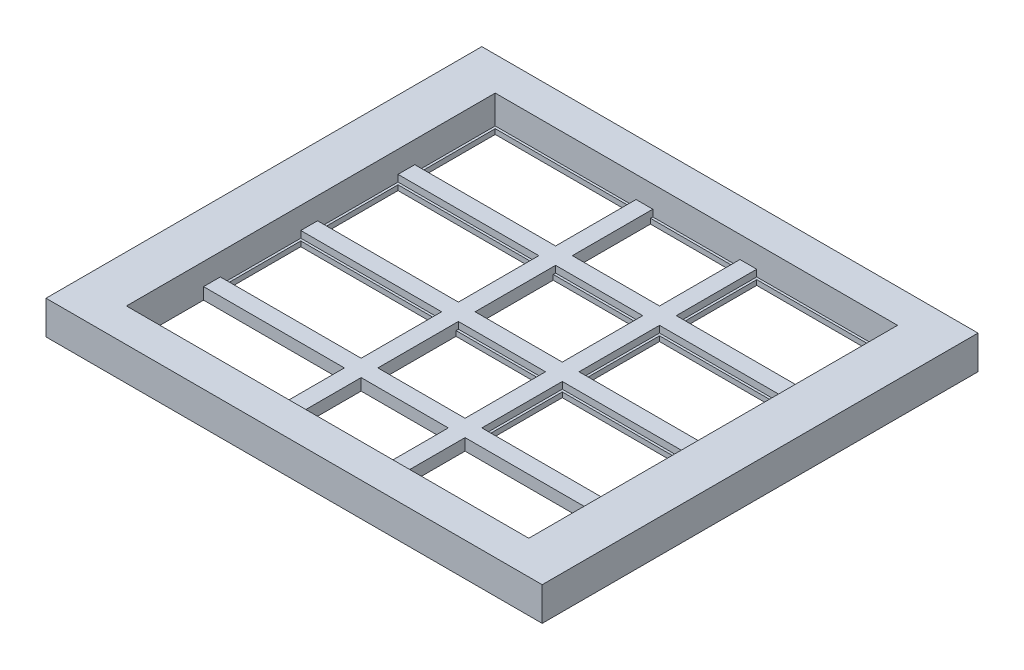
from build123d import *

# Parameters (mm, degrees)
SKETCH1_W            = 148
SKETCH1_H            = 130
BOSS_EXTRUDE2_DEPTH  = 10
SKETCH2_W            = 120
SKETCH2_H            = 110
SKETCH2_W_2          = 118.6
SKETCH2_H_2          = 22.6
SKETCH2_H_3          = 21.6
BOSS_EXTRUDE3_DEPTH  = 1.5
SKETCH3_W            = 120
SKETCH3_H            = 5
BOSS_EXTRUDE4_DEPTH  = 2
SKETCH4_W            = 5
SKETCH4_H            = 110
BOSS_EXTRUDE5_DEPTH  = 3.5
SKETCH5_W            = 5
SKETCH5_H            = 22.6
SKETCH5_H_2          = 21.6
CUT_EXTRUDE1_DEPTH   = 10
SKETCH6_W            = 5
SKETCH6_H            = 0.7
CUT_EXTRUDE2_DEPTH   = 2
SKETCH7_W            = 5
SKETCH7_H            = 24
BOSS_EXTRUDE7_DEPTH  = 3.5
SKETCH8_W            = 0.7
SKETCH8_H            = 22.6
BOSS_EXTRUDE8_DEPTH  = 1.5
SKETCH9_W            = 26
SKETCH9_H            = 0.7
CUT_EXTRUDE3_DEPTH   = 1.5
SKETCH10_W           = 0.7
SKETCH10_H           = 22.6
BOSS_EXTRUDE9_DEPTH  = 1.5
SKETCH11_W           = 5
SKETCH11_H           = 70
BOSS_EXTRUDE10_DEPTH = 3


with BuildPart() as part:
    # Sketch1 → Boss-Extrude2 (new body)
    with BuildSketch(Plane(origin=(0, 0, 0), x_dir=(1, 0, 0), z_dir=(0, 1, 0))):
        with Locations((110.217300352, 48.854396258)):
            Rectangle(SKETCH1_W, SKETCH1_H)
        Polygon((170.217300352, -6.145603742), (50.217300352, -6.145603742), (50.217300352, 16.854396258), (50.217300352, 21.854396258), (50.217300352, 45.854396258), (50.217300352, 50.854396258), (50.217300352, 74.854396258), (50.217300352, 79.854396258), (50.217300352, 103.854396258), (170.217300352, 103.854396258), (170.217300352, 79.854396258), (170.217300352, 74.854396258), (170.217300352, 50.854396258), (170.217300352, 45.854396258), (170.217300352, 21.854396258), (170.217300352, 16.854396258), align=None, mode=Mode.SUBTRACT)
    extrude(amount=BOSS_EXTRUDE2_DEPTH)

    # Sketch2 → Boss-Extrude3 (add)
    with BuildSketch(Plane.XZ):
        with Locations((110.217300352, -48.854396258)):
            Rectangle(SKETCH2_W, SKETCH2_H)
        with Locations((110.217300352, -91.854396258)):
            Rectangle(SKETCH2_W_2, SKETCH2_H_2, mode=Mode.SUBTRACT)
        with Locations((110.217300352, -62.854396258)):
            Rectangle(SKETCH2_W_2, SKETCH2_H_2, mode=Mode.SUBTRACT)
        with Locations((110.217300352, -33.854396258)):
            Rectangle(SKETCH2_W_2, SKETCH2_H_2, mode=Mode.SUBTRACT)
        with Locations((110.217300352, -5.354396258)):
            Rectangle(SKETCH2_W_2, SKETCH2_H_3, mode=Mode.SUBTRACT)
    extrude(amount=-BOSS_EXTRUDE3_DEPTH)

    # Sketch3 → Boss-Extrude4 (add)
    with BuildSketch(Plane(origin=(0, 1.5, 0), x_dir=(1, 0, 0), z_dir=(0, 1, 0))):
        with Locations((110.217300352, 77.354396258)):
            Rectangle(SKETCH3_W, SKETCH3_H)
        with Locations((110.217300352, 48.354396258)):
            Rectangle(SKETCH3_W, SKETCH3_H)
        with Locations((110.217300352, 19.354396258)):
            Rectangle(SKETCH3_W, SKETCH3_H)
    extrude(amount=BOSS_EXTRUDE4_DEPTH)

    # Sketch4 → Boss-Extrude5 (add)
    with BuildSketch(Plane(origin=(0, 0, 0), x_dir=(-1, 0, 0), z_dir=(0, -1, 0))):
        with Locations((-89.717300352, 48.854396258)):
            Rectangle(SKETCH4_W, SKETCH4_H)
        with Locations((-125.717300352, 48.854396258)):
            Rectangle(SKETCH4_W, SKETCH4_H)
    extrude(amount=-BOSS_EXTRUDE5_DEPTH)

    # Sketch5 → Cut-Extrude1 (cut)
    with BuildSketch(Plane(origin=(0, 0, 0), x_dir=(-1, 0, 0), z_dir=(0, -1, 0))):
        with Locations((-89.717300352, 91.854396258)):
            Rectangle(SKETCH5_W, SKETCH5_H)
        with Locations((-89.717300352, 5.354396258)):
            Rectangle(SKETCH5_W, SKETCH5_H_2)
        with Locations((-89.717300352, 33.854396258)):
            Rectangle(SKETCH5_W, SKETCH5_H)
        with Locations((-89.717300352, 62.854396258)):
            Rectangle(SKETCH5_W, SKETCH5_H)
    extrude(amount=-CUT_EXTRUDE1_DEPTH, mode=Mode.SUBTRACT)

    # Sketch6 → Cut-Extrude2 (cut)
    with BuildSketch(Plane(origin=(0, 1.5, 0), x_dir=(1, 0, 0), z_dir=(0, 1, 0))):
        with Locations((89.717300352, 103.504396258)):
            Rectangle(SKETCH6_W, SKETCH6_H)
        with Locations((89.717300352, 80.204396258)):
            Rectangle(SKETCH6_W, SKETCH6_H)
        with Locations((89.717300352, 74.504396258)):
            Rectangle(SKETCH6_W, SKETCH6_H)
        with Locations((89.717300352, 51.204396258)):
            Rectangle(SKETCH6_W, SKETCH6_H)
        with Locations((89.717300352, 45.504396258)):
            Rectangle(SKETCH6_W, SKETCH6_H)
        with Locations((89.717300352, 22.204396258)):
            Rectangle(SKETCH6_W, SKETCH6_H)
        with Locations((89.717300352, 16.504396258)):
            Rectangle(SKETCH6_W, SKETCH6_H)
        with Locations((89.717300352, -5.795603742)):
            Rectangle(SKETCH6_W, SKETCH6_H)
    extrude(amount=CUT_EXTRUDE2_DEPTH, mode=Mode.SUBTRACT)

    # Sketch7 → Boss-Extrude7 (add)
    with BuildSketch(Plane(origin=(0, 0, 0), x_dir=(-1, 0, 0), z_dir=(0, -1, 0))):
        with Locations((-94.717300352, 91.854396258)):
            Rectangle(SKETCH7_W, SKETCH7_H)
        with Locations((-94.717300352, 62.854396258)):
            Rectangle(SKETCH7_W, SKETCH7_H)
        Polygon((-97.217300352, 16.854396258), (-97.217300352, -6.145603742), (-92.217300352, -6.170565448), (-92.217300352, 16.854396258), align=None)
        with Locations((-94.717300352, 33.854396258)):
            Rectangle(SKETCH7_W, SKETCH7_H)
    extrude(amount=-BOSS_EXTRUDE7_DEPTH)

    # Sketch8 → Boss-Extrude8 (add)
    with BuildSketch(Plane(origin=(0, 0, 0), x_dir=(-1, 0, 0), z_dir=(0, -1, 0))):
        with Locations((-91.867300352, 91.854396258)):
            Rectangle(SKETCH8_W, SKETCH8_H)
        with Locations((-91.867300352, 62.854396258)):
            Rectangle(SKETCH8_W, SKETCH8_H)
        with Locations((-91.867300352, 33.854396258)):
            Rectangle(SKETCH8_W, SKETCH8_H)
    extrude(amount=-BOSS_EXTRUDE8_DEPTH)

    # Sketch9 → Cut-Extrude3 (cut)
    with BuildSketch(Plane(origin=(0, 0, 0), x_dir=(-1, 0, 0), z_dir=(0, -1, 0))):
        Polygon((-50.217300352, 16.854396258), (-92.217300352, 16.854396258), (-92.217300352, 16.154396258), (-50.917300352, 16.154396258), (-50.917300352, -5.445603742), (-92.217300352, -5.445603742), (-92.217300352, -6.145603742), (-50.217300352, -6.145603742), align=None)
        Polygon((-170.217300352, -6.145603742), (-128.217300352, -6.145603742), (-128.217300352, -5.445603742), (-169.517300352, -5.445603742), (-169.517300352, 16.154396258), (-128.217300352, 16.154396258), (-128.217300352, 16.854396258), (-170.217300352, 16.854396258), align=None)
        with Locations((-110.217300352, 16.504396258)):
            Rectangle(SKETCH9_W, SKETCH9_H)
        with Locations((-110.217300352, -5.795603742)):
            Rectangle(SKETCH9_W, SKETCH9_H)
    extrude(amount=-CUT_EXTRUDE3_DEPTH, mode=Mode.SUBTRACT)

    # Sketch10 → Boss-Extrude9 (add)
    with BuildSketch(Plane(origin=(0, 0, 0), x_dir=(-1, 0, 0), z_dir=(0, -1, 0))):
        with Locations((-128.567300352, 91.854396258)):
            Rectangle(SKETCH10_W, SKETCH10_H)
        with Locations((-128.567300352, 62.854396258)):
            Rectangle(SKETCH10_W, SKETCH10_H)
        with Locations((-128.567300352, 33.854396258)):
            Rectangle(SKETCH10_W, SKETCH10_H)
    extrude(amount=-BOSS_EXTRUDE9_DEPTH)

    # Sketch11 → Boss-Extrude10 (add)
    with BuildSketch(Plane(origin=(0, 0, 0), x_dir=(-1, 0, 0), z_dir=(0, -1, 0))):
        with Locations((-43.217300352, 48.854396258)):
            Rectangle(SKETCH11_W, SKETCH11_H)
        with Locations((-177.217300352, 48.854396258)):
            Rectangle(SKETCH11_W, SKETCH11_H)
    extrude(amount=BOSS_EXTRUDE10_DEPTH)


solid = part.part
